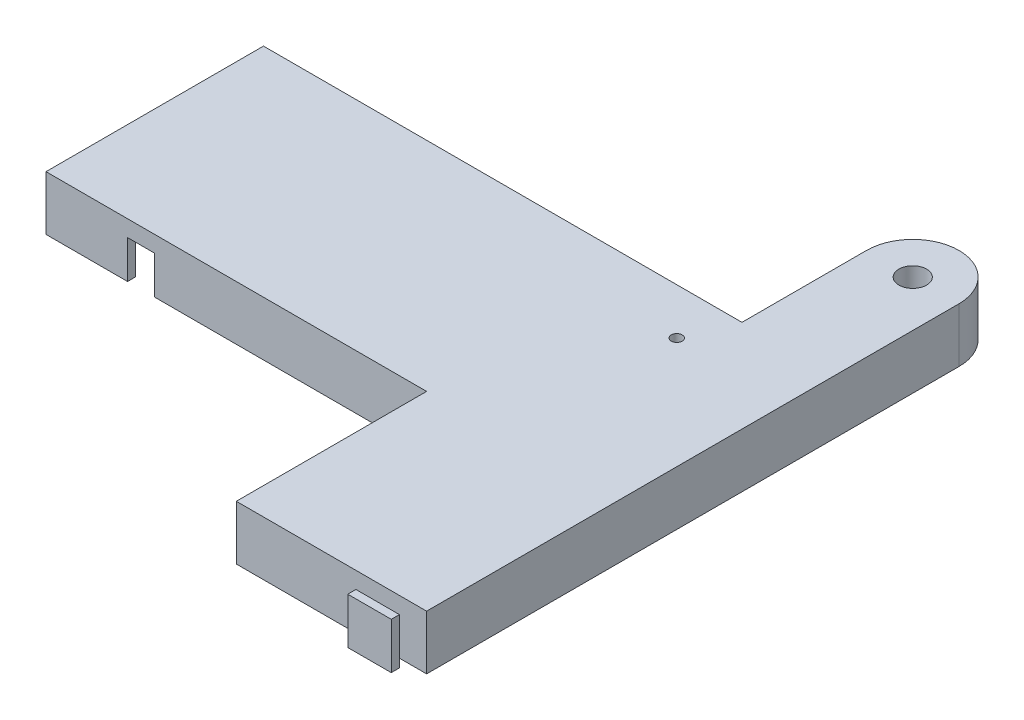
from build123d import *

# Parameters (mm, degrees)
CORNERBOSS_EXTRUDE1_DEPTH               = 20
SHELL1_T                                = -3
PADSKETCH2_R                            = 12
PADSKETCH2_R_2                          = 5
PADBOSS_EXTRUDE2_DEPTH                  = 10
STEPPERRODHOLESKETCH3_R                 = 5.1
STEPPERRODHOLESKETCH3_R_2               = 2
STEPPERRODHOLECUT_EXTRUDE1_DEPTH        = 255.298998474
THREADEDNUTMOUNTHOLESSKETCH4_R          = 2
THREADEDNUTMOUNTHOLESCUT_EXTRUDE2_DEPTH = 10
TLPEGHOLESKETCH1_W                      = 10
TLPEGHOLESKETCH1_H                      = 14
TLPEGHOLECUT_EXTRUDE1_DEPTH             = 3
BOTTOMPEGSKETCH2_W                      = 9.8
BOTTOMPEGSKETCH2_H                      = 13.9
BOTTOMPEGBOSS_EXTRUDE1_DEPTH            = 3.1
BOTTOMPEGCAPSKETCH3_W                   = 16
BOTTOMPEGCAPSKETCH3_H                   = 17
BOTTOMPEGCAPBOSS_EXTRUDE2_DEPTH         = 3
BEDCENTERHOLECUTSKETCH1_W               = 10
BEDCENTERHOLECUTSKETCH1_H               = 14
BEDCENTERHOLECUT_EXTRUDE1_DEPTH         = 3


with BuildPart() as part:
    # CornerSketch1 → CornerBoss-Extrude1 (new body)
    with BuildSketch(Plane(origin=(0, 0, 0), x_dir=(1, 0, 0), z_dir=(0, 1, 0))):
        with BuildLine():
            Line((210, -70), (140, -70))
            Line((140, -70), (140, 0))
            Line((140, 0), (0, 0))
            Line((0, 0), (0, 80))
            Line((0, 80), (176, 80))
            Line((176, 80), (176, 125.825))
            ThreePointArc((176, 125.825), (193, 142.825), (210, 125.825))
            Line((210, 125.825), (210, -70))
        make_face()
    extrude(amount=CORNERBOSS_EXTRUDE1_DEPTH)

    # Shell1
    shell1_openings = [part.faces().sort_by_distance(p)[0] for p in [
        (126.932214483, 0, -30.416556174),
    ]]
    offset(amount=SHELL1_T, openings=shell1_openings, kind=Kind.INTERSECTION)

    # PadSketch2 → PadBoss-Extrude2 (add)
    with BuildSketch(Plane.XZ.offset(-17)):
        with Locations((193, -125.825)):
            Circle(PADSKETCH2_R)
        with Locations((169, -63)):
            Circle(PADSKETCH2_R_2)
    extrude(amount=PADBOSS_EXTRUDE2_DEPTH)

    # StepperRodHoleSketch3 → StepperRodHoleCut-Extrude1 (cut, through all)
    with BuildSketch(Plane.XZ.offset(-7)):
        with Locations((193, -125.825)):
            Circle(STEPPERRODHOLESKETCH3_R)
        with Locations((169, -63)):
            Circle(STEPPERRODHOLESKETCH3_R_2)
    extrude(amount=-STEPPERRODHOLECUT_EXTRUDE1_DEPTH, mode=Mode.SUBTRACT)

    # ThreadedNutMountHolesSketch4 → ThreadedNutMountHolesCut-Extrude2 (cut)
    with BuildSketch(Plane(origin=(0, 7, 0), x_dir=(-1, 0, 0), z_dir=(0, -1, 0))):
        with Locations((-193, 133.825)):
            Circle(THREADEDNUTMOUNTHOLESSKETCH4_R)
        with Locations((-185, 125.825)):
            Circle(THREADEDNUTMOUNTHOLESSKETCH4_R)
        with Locations((-201, 125.825)):
            Circle(THREADEDNUTMOUNTHOLESSKETCH4_R)
        with Locations((-193, 117.825)):
            Circle(THREADEDNUTMOUNTHOLESSKETCH4_R)
    extrude(amount=-THREADEDNUTMOUNTHOLESCUT_EXTRUDE2_DEPTH, mode=Mode.SUBTRACT)

    # TLPegHoleSketch1 → TLPegHoleCut-Extrude1 (cut)
    with BuildSketch(Plane.ZY):
        with Locations((-65, 7)):
            Rectangle(TLPEGHOLESKETCH1_W, TLPEGHOLESKETCH1_H)
    extrude(amount=-TLPEGHOLECUT_EXTRUDE1_DEPTH, mode=Mode.SUBTRACT)

    # BottomPegSketch2 → BottomPegBoss-Extrude1 (add)
    with BuildSketch(Plane.XY.offset(70)):
        with Locations((195, 6.95)):
            Rectangle(BOTTOMPEGSKETCH2_W, BOTTOMPEGSKETCH2_H)
    extrude(amount=BOTTOMPEGBOSS_EXTRUDE1_DEPTH)

    # BottomPegCapSketch3 → BottomPegCapBoss-Extrude2 (add)
    with BuildSketch(Plane.XY.offset(73.1)):
        with Locations((195.1, 8.5)):
            Rectangle(BOTTOMPEGCAPSKETCH3_W, BOTTOMPEGCAPSKETCH3_H)
    extrude(amount=BOTTOMPEGCAPBOSS_EXTRUDE2_DEPTH)

    # BedCenterHoleCutSketch1 → BedCenterHoleCut-Extrude1 (cut)
    with BuildSketch(Plane.XY):
        with Locations((35, 7)):
            Rectangle(BEDCENTERHOLECUTSKETCH1_W, BEDCENTERHOLECUTSKETCH1_H)
    extrude(amount=-BEDCENTERHOLECUT_EXTRUDE1_DEPTH, mode=Mode.SUBTRACT)


solid = part.part
